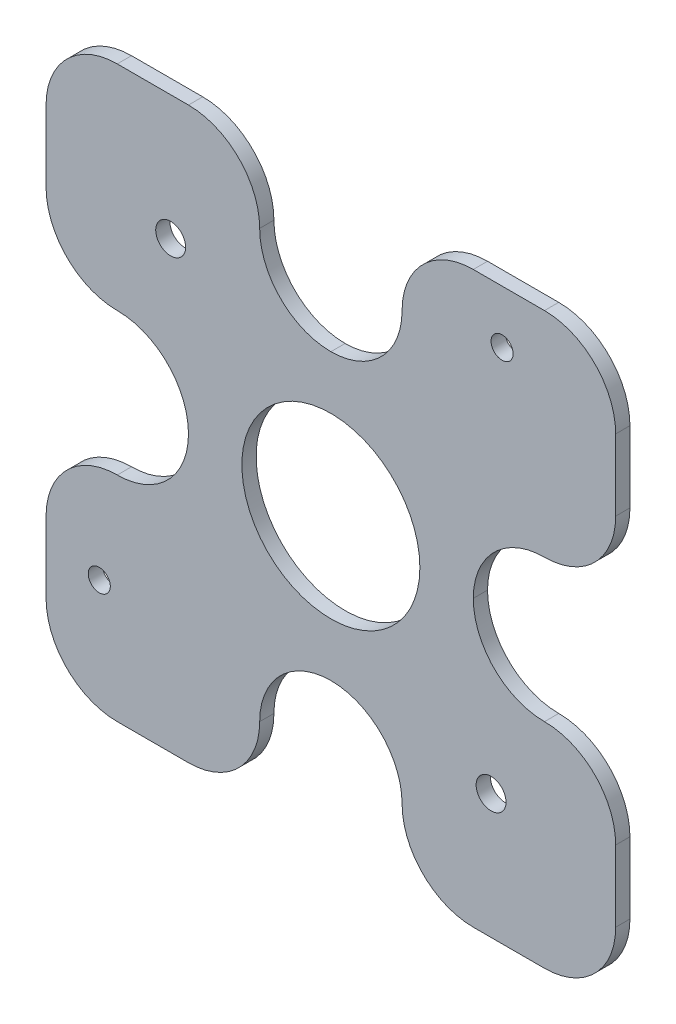
from build123d import *

# Parameters (mm, degrees)
SKETCH_1_W          = 80
SKETCH_1_H          = 80
SKETCH_1_R          = 2.1
SKETCH_1_R_2        = 1.55
EXTRUDE_1_DEPTH     = 2
SKETCH_2_W          = 20
SKETCH_2_H          = 20
CUT_EXTRUDE_1_DEPTH = 2
FILLET_1_R          = 10
SKETCH_3_R          = 12.5
CUT_EXTRUDE_2_DEPTH = 2


with BuildPart() as part:
    # 草图1 → 凸台-拉伸1 (new body)
    with BuildSketch(Plane.XY):
        with Locations((40, 40)):
            Rectangle(SKETCH_1_W, SKETCH_1_H)
        with Locations((17.5, 62.5)):
            Circle(SKETCH_1_R, mode=Mode.SUBTRACT)
        with Locations((62.5, 17.5)):
            Circle(SKETCH_1_R, mode=Mode.SUBTRACT)
        with Locations((7.473088065, 15.95836944)):
            Circle(SKETCH_1_R_2, mode=Mode.SUBTRACT)
        with Locations(Location((64.04163056, 72.526911935, 0), (0, 0, 180))):
            Circle(SKETCH_1_R_2, mode=Mode.SUBTRACT)
    extrude(amount=EXTRUDE_1_DEPTH)

    # 草图2 → 切除-拉伸1 (cut)
    with BuildSketch(Plane.XY.offset(2)):
        with Locations((40, 70)):
            Rectangle(SKETCH_2_W, SKETCH_2_H)
        with Locations((70, 40)):
            Rectangle(SKETCH_2_W, SKETCH_2_H)
        with Locations((40, 10)):
            Rectangle(SKETCH_2_W, SKETCH_2_H)
        with Locations((10, 40)):
            Rectangle(SKETCH_2_W, SKETCH_2_H)
    extrude(amount=-CUT_EXTRUDE_1_DEPTH, mode=Mode.SUBTRACT)

    # 圆角1
    fillet_1_edges = [part.edges().sort_by_distance(p)[0] for p in [
        (0, 50, 1),
        (20, 50, 1),
        (20, 30, 1),
        (0, 30, 1),
        (0, 0, 1),
        (30, 0, 1),
        (30, 20, 1),
        (50, 20, 1),
        (50, 0, 1),
        (80, 0, 1),
        (80, 30, 1),
        (60, 30, 1),
        (60, 50, 1),
        (80, 50, 1),
        (80, 80, 1),
        (50, 80, 1),
        (50, 60, 1),
        (30, 60, 1),
        (30, 80, 1),
        (0, 80, 1),
    ]]
    fillet(fillet_1_edges, radius=FILLET_1_R - 0.0001)  # a hair under: the kernel refuses the full size

    # 草图3 → 切除-拉伸2 (cut)
    with BuildSketch(Plane.XY.offset(2)):
        with Locations((40, 40)):
            Circle(SKETCH_3_R)
    extrude(amount=-CUT_EXTRUDE_2_DEPTH, mode=Mode.SUBTRACT)


solid = part.part
